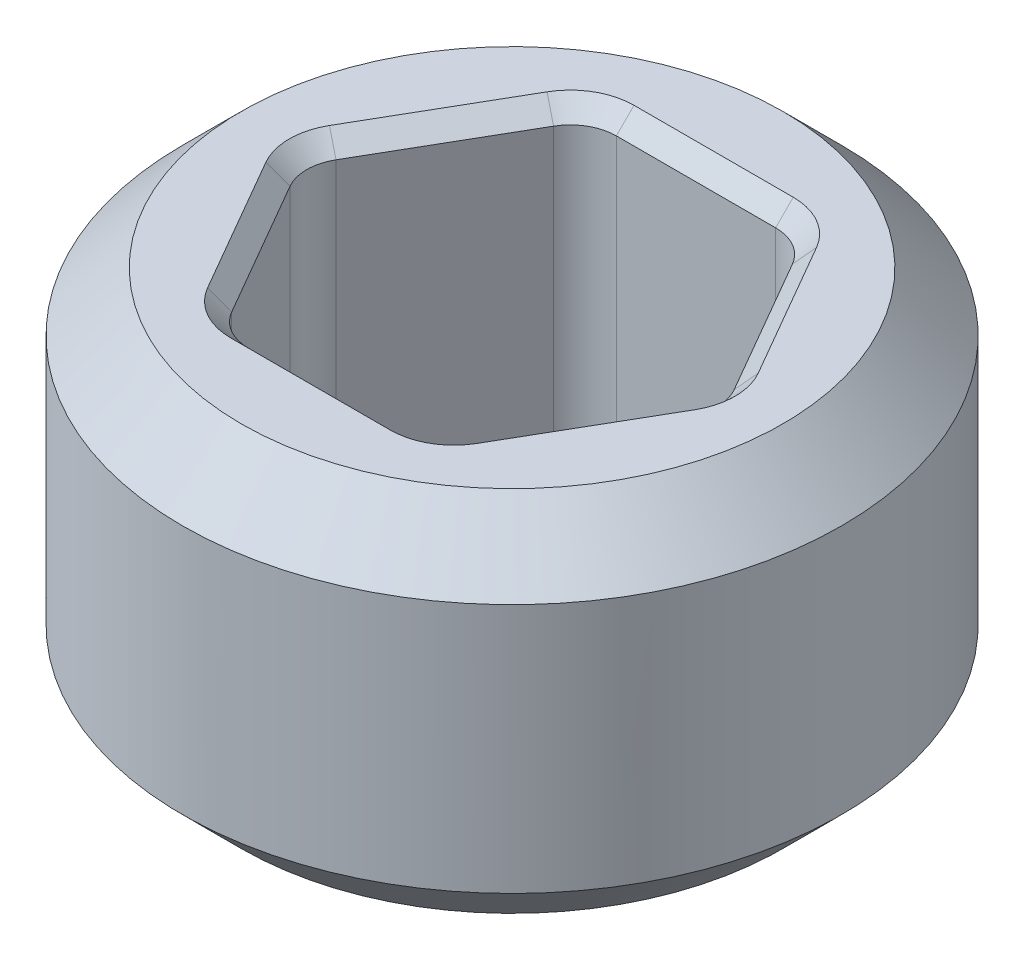
from build123d import *

# Parameters (mm, degrees)
SKETCH1_W               = 1.4224
SKETCH1_H               = 1.5875
CUT_EXTRUDE1_DEPTH      = 3.162517649
CUT_EXTRUDE1_DEPTH_BACK = 3.162517649
FILLET1_R               = 0.1984375
CHAMFER1_SIZE           = 0.254
CHAMFER2_SIZE           = 0.0762


with BuildPart() as part:
    # Sketch1 → Revolve1 (revolve)
    with BuildSketch(Plane.XY):
        with Locations((0.7112, 0)):
            Rectangle(SKETCH1_W, SKETCH1_H)
    revolve(axis=Axis((0, -1.704166029, 0), (0, 1, 0)))

    # Sketch3 → Cut-Extrude1 (cut, two sides: drawn at the far end of the back side and taken through both)
    with BuildSketch(Plane(origin=(0, 0, 0), x_dir=(1, 0, 0), z_dir=(0, 1, 0)).offset(-CUT_EXTRUDE1_DEPTH_BACK)):
        Polygon((0.916543552, 0), (0.458271776, 0.79375), (-0.458271776, 0.79375), (-0.916543552, 0), (-0.458271776, -0.79375), (0.458271776, -0.79375), align=None)
    extrude(amount=CUT_EXTRUDE1_DEPTH + CUT_EXTRUDE1_DEPTH_BACK, mode=Mode.SUBTRACT)

    # Fillet1
    fillet1_edges = [part.edges().sort_by_distance(p)[0] for p in [
        (0.458271776, 0, -0.79375),
        (0.916543552, 0, 0),
        (0.458271776, 0, 0.79375),
        (-0.458271776, 0, 0.79375),
        (-0.916543552, 0, 0),
        (-0.458271776, 0, -0.79375),
    ]]
    fillet(fillet1_edges, radius=FILLET1_R)

    # Chamfer1
    chamfer1_edges = [part.edges().sort_by_distance(p)[0] for p in [
        (-1.4224, -0.79375, 0),
        (-1.4224, 0.79375, 0),
    ]]
    chamfer(chamfer1_edges, length=CHAMFER1_SIZE)

    # Chamfer2
    chamfer2_edges = [part.edges().sort_by_distance(p)[0] for p in [
        (0.687407664, 0.79375, -0.396875),
        (0.442922582, 0.79375, -0.767164416),
        (0.885845164, 0.79375, 0),
        (0, 0.79375, -0.79375),
        (0.687407664, 0.79375, 0.396875),
        (-0.442922582, 0.79375, -0.767164416),
        (0.442922582, 0.79375, 0.767164416),
        (-0.687407664, 0.79375, -0.396875),
        (0, 0.79375, 0.79375),
        (-0.885845164, 0.79375, 0),
        (-0.442922582, 0.79375, 0.767164416),
        (-0.687407664, 0.79375, 0.396875),
        (0.687407664, -0.79375, 0.396875),
        (0.885845164, -0.79375, 0),
        (0.442922582, -0.79375, 0.767164416),
        (0.687407664, -0.79375, -0.396875),
        (0, -0.79375, 0.79375),
        (0.442922582, -0.79375, -0.767164416),
        (-0.442922582, -0.79375, 0.767164416),
        (0, -0.79375, -0.79375),
        (-0.687407664, -0.79375, 0.396875),
        (-0.442922582, -0.79375, -0.767164416),
        (-0.885845164, -0.79375, 0),
        (-0.687407664, -0.79375, -0.396875),
    ]]
    chamfer(chamfer2_edges, length=CHAMFER2_SIZE)


solid = part.part
